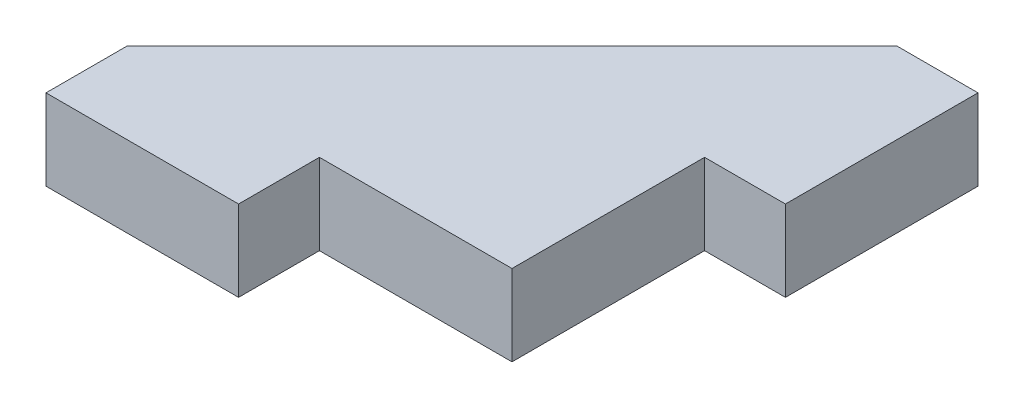
from build123d import *

# Parameters (mm, degrees)
BOSS_EXTRUDE1_DEPTH = 5.334


with BuildPart() as part:
    # Sketch1 → Boss-Extrude1 (new body)
    with BuildSketch(Plane(origin=(0, 0, 0), x_dir=(1, 0, 0), z_dir=(0, 1, 0))):
        Polygon((4.338014563, 11.777885777), (-21.061985437, -13.622114223), (-21.061985437, -18.956114223), (-8.361985437, -18.956114223), (-8.361985437, -13.622114223), (4.338014563, -13.622114223), (4.338014563, -0.922114223), (9.672014563, -0.922114223), (9.672014563, 11.777885777), align=None)
    extrude(amount=BOSS_EXTRUDE1_DEPTH)


solid = part.part
